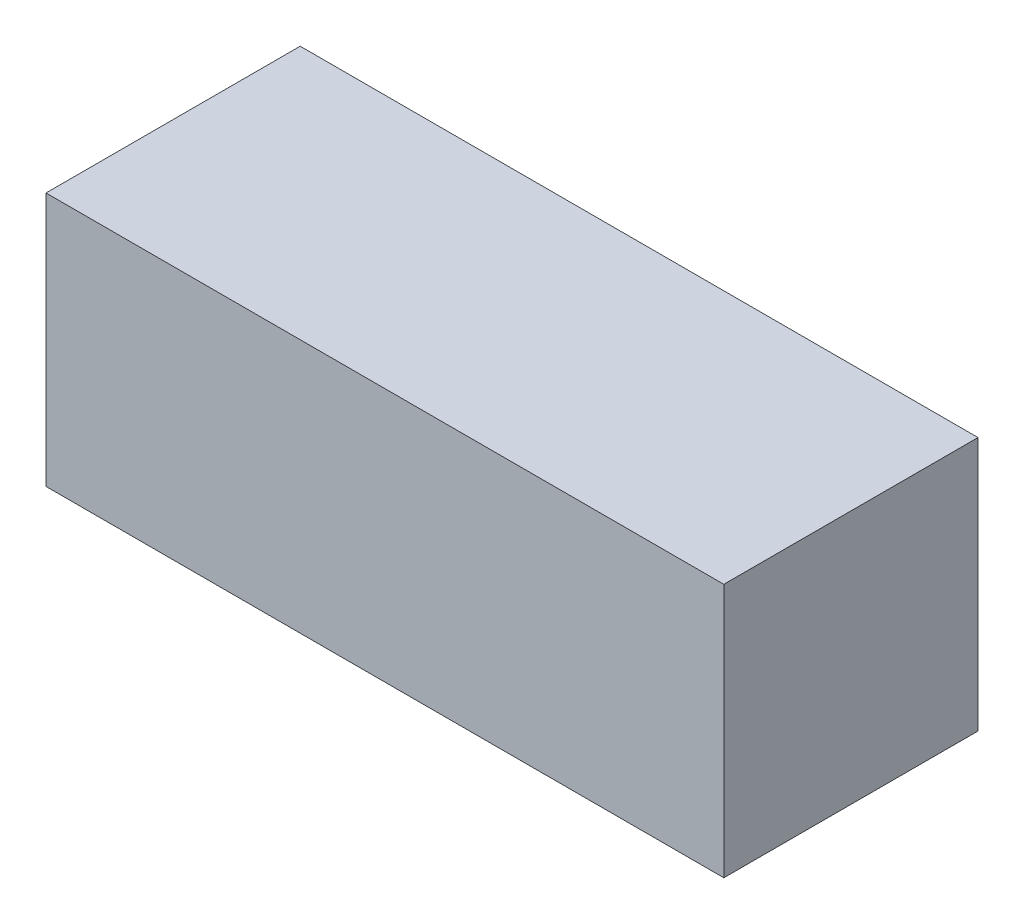
from build123d import *

# Parameters (mm, degrees)
SKETCH_1_W      = 120
SKETCH_1_H      = 45
EXTRUDE_1_DEPTH = 45


with BuildPart() as part:
    # 草图1 → 凸台-拉伸1 (new body)
    with BuildSketch(Plane.XY):
        Rectangle(SKETCH_1_W, SKETCH_1_H)
    extrude(amount=EXTRUDE_1_DEPTH)


solid = part.part
